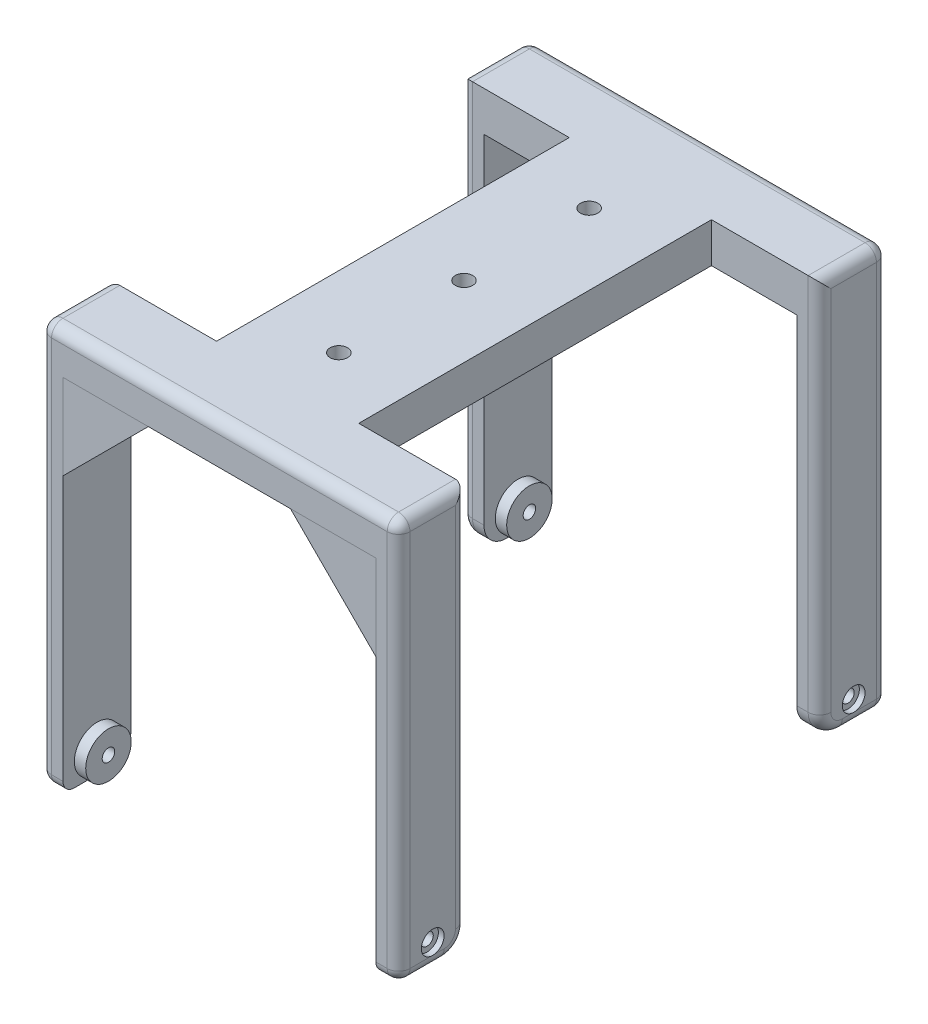
from build123d import *

# Parameters (mm, degrees)
SKETCH_1_W          = 63
SKETCH_1_H          = 12
EXTRUDE_1_DEPTH     = 70.5
SKETCH_2_W          = 55
SKETCH_2_H          = 63.5
CUT_EXTRUDE_1_DEPTH = 79.144097666
SKETCH_4_W          = 25
SKETCH_4_H          = 7
EXTRUDE_2_DEPTH     = 62
EXTRUDE_3_DEPTH     = 12
SKETCH_3_R          = 1.1
CUT_EXTRUDE_2_DEPTH = 124.851725866
EXTRUDE_START       = 2
SKETCH_7_R          = 4
SKETCH_7_R_2        = 1.1
EXTRUDE_4_DEPTH     = 2
SKETCH_8_R          = 4
SKETCH_8_R_2        = 1.1
EXTRUDE_5_DEPTH     = 2
EXTRUDE_6_DEPTH     = 4
EXTRUDE_6_2_DEPTH   = 4
EXTRUDE_7_DEPTH     = 4
SKETCH_9_R          = 1.1
CUT_EXTRUDE_3_DEPTH = 107.885452705
SKETCH_10_R         = 4.1
CUT_EXTRUDE_4_DEPTH = 2
SKETCH_11_R         = 2
CUT_EXTRUDE_5_DEPTH = 1
CUT_EXTRUDE_START   = -1
SKETCH_12_R         = 2
CUT_EXTRUDE_6_DEPTH = 1
SKETCH_15_R         = 1.525
CUT_EXTRUDE_7_DEPTH = 3
FILLET_1_R          = 4
FILLET_2_R          = 2
FILLET_3_R          = 2
FILLET_4_R          = 2


with BuildPart() as part:
    # 草图1 → 凸台-拉伸1 (new body)
    with BuildSketch(Plane(origin=(0, 0, 0), x_dir=(1, 0, 0), z_dir=(0, 1, 0))):
        Rectangle(SKETCH_1_W, SKETCH_1_H)
    extrude(amount=EXTRUDE_1_DEPTH)

    # 草图2 → 切除-拉伸1 (cut, through all)
    with BuildSketch(Plane.XY.offset(6)):
        with Locations((0, 31.75)):
            Rectangle(SKETCH_2_W, SKETCH_2_H)
    extrude(amount=-CUT_EXTRUDE_1_DEPTH, mode=Mode.SUBTRACT)

    # 草图4 → 凸台-拉伸2 (add)
    with BuildSketch(Plane(origin=(0, 0, -6), x_dir=(-1, 0, 0), z_dir=(0, 0, -1))):
        with Locations((0, 67)):
            Rectangle(SKETCH_4_W, SKETCH_4_H)
    extrude(amount=EXTRUDE_2_DEPTH)

    # 草图5 → 凸台-拉伸3 (add)
    with BuildSketch(Plane(origin=(0, 0, -68), x_dir=(-1, 0, 0), z_dir=(0, 0, -1))):
        Polygon((12.5, 63.5), (27.5, 63.5), (27.5, 0), (31.5, 0), (31.5, 70.5), (12.5, 70.5), (-12.5, 70.5), (-31.5, 70.5), (-31.5, 0), (-27.5, 0), (-27.5, 63.5), (-12.5, 63.5), align=None)
    extrude(amount=EXTRUDE_3_DEPTH)

    # 草图3 → 切除-拉伸2 (cut, through all)
    with BuildSketch(Plane(origin=(31.5, 0, 0), x_dir=(0, 0, -1), z_dir=(1, 0, 0))):
        with Locations((0, 4)):
            Circle(SKETCH_3_R)
        with Locations((74, 4)):
            Circle(SKETCH_3_R)
    extrude(amount=-CUT_EXTRUDE_2_DEPTH, mode=Mode.SUBTRACT)

    # 草图7 → 凸台-拉伸4 (add)
    # profile 1 of 2: a face of its own
    with BuildSketch(Plane(origin=(-27.5, 0, 0), x_dir=(0, 0, -1), z_dir=(1, 0, 0)).offset(EXTRUDE_START)):
        with Locations(Location((0, 4, 0), (0, 0, 270))):
            Circle(SKETCH_7_R)
        with Locations((0, 4)):
            Circle(SKETCH_7_R_2, mode=Mode.SUBTRACT)
    # profile 2 of 2: a face of its own
    with BuildSketch(Plane(origin=(-27.5, 0, 0), x_dir=(0, 0, -1), z_dir=(1, 0, 0)).offset(EXTRUDE_START)):
        with Locations(Location((74, 4, 0), (0, 0, 270))):
            Circle(SKETCH_7_R)
        with Locations((74, 4)):
            Circle(SKETCH_7_R_2, mode=Mode.SUBTRACT)
    extrude(amount=-EXTRUDE_4_DEPTH)

    # 草图8 → 凸台-拉伸5 (add)
    # profile 1 of 2: a face of its own
    with BuildSketch(Plane.ZY.offset(-27.5)):
        with Locations(Location((-74, 4, 0), (0, 0, 270))):
            Circle(SKETCH_8_R)
        with Locations(Location((-74, 4, 0), (0, 0, 180))):
            Circle(SKETCH_8_R_2, mode=Mode.SUBTRACT)
    # profile 2 of 2: a face of its own
    with BuildSketch(Plane.ZY.offset(-27.5)):
        with Locations(Location((0, 4, 0), (0, 0, 270))):
            Circle(SKETCH_8_R)
        with Locations(Location((0, 4, 0), (0, 0, 180))):
            Circle(SKETCH_8_R_2, mode=Mode.SUBTRACT)
    extrude(amount=EXTRUDE_5_DEPTH)

    # 草图14 → 凸台-拉伸7 (add)
    with BuildSketch(Plane(origin=(0, 0, -80), x_dir=(-1, 0, 0), z_dir=(0, 0, -1))):
        Polygon((27.5, 63.5), (12.5, 63.5), (27.5, 48.5), align=None)
        Polygon((-27.5, 63.5), (-27.5, 48.5), (-12.5, 63.5), align=None)
    extrude(amount=-EXTRUDE_7_DEPTH)

    # 草图9 → 切除-拉伸3 (cut, through all)
    with BuildSketch(Plane.XZ.offset(-63.5)):
        with Locations(Location((0, -15, 0), (0, 0, 270))):
            Circle(SKETCH_9_R)
        with Locations(Location((0, -59, 0), (0, 0, 270))):
            Circle(SKETCH_9_R)
        with Locations(Location((0, -37, 0), (0, 0, 270))):
            Circle(SKETCH_9_R)
    extrude(amount=-CUT_EXTRUDE_3_DEPTH, mode=Mode.SUBTRACT)

    # 草图10 → 切除-拉伸4 (cut)
    with BuildSketch(Plane.XZ.offset(-63.5)):
        with Locations(Location((0, -15, 0), (0, 0, 270))):
            Circle(SKETCH_10_R)
        with Locations(Location((0, -59, 0), (0, 0, 270))):
            Circle(SKETCH_10_R)
        with Locations(Location((0, -37, 0), (0, 0, 270))):
            Circle(SKETCH_10_R)
    extrude(amount=-CUT_EXTRUDE_4_DEPTH, mode=Mode.SUBTRACT)

    # 草图11 → 切除-拉伸5 (cut)
    with BuildSketch(Plane(origin=(31.5, 0, 0), x_dir=(0, 0, -1), z_dir=(1, 0, 0))):
        with Locations((0, 4)):
            Circle(SKETCH_11_R)
        with Locations((74, 4)):
            Circle(SKETCH_11_R)
    extrude(amount=-CUT_EXTRUDE_5_DEPTH, mode=Mode.SUBTRACT)

    # 草图12 → 切除-拉伸6 (cut)
    with BuildSketch(Plane.ZY.offset(31.5).offset(CUT_EXTRUDE_START)):
        with Locations(Location((-74, 4, 0), (0, 0, 180))):
            Circle(SKETCH_12_R)
        with Locations(Location((0, 4, 0), (0, 0, 180))):
            Circle(SKETCH_12_R)
    extrude(amount=CUT_EXTRUDE_6_DEPTH, mode=Mode.SUBTRACT)

    # 草图15 → 切除-拉伸7 (cut)
    with BuildSketch(Plane(origin=(0, 70.5, 0), x_dir=(1, 0, 0), z_dir=(0, 1, 0))):
        with Locations(Location((0, 59, 0), (0, 0, 270))):
            Circle(SKETCH_15_R)
        with Locations(Location((0, 37, 0), (0, 0, 270))):
            Circle(SKETCH_15_R)
        with Locations(Location((0, 15, 0), (0, 0, 270))):
            Circle(SKETCH_15_R)
    extrude(amount=-CUT_EXTRUDE_7_DEPTH, mode=Mode.SUBTRACT)

    # 圆角1
    fillet_1_edges = [part.edges().sort_by_distance(p)[0] for p in [
        (-29.5, 0, -6),
        (29.5, 0, -68),
        (-29.5, 0, -68),
        (29.5, 0, -6),
    ]]
    fillet(fillet_1_edges, radius=FILLET_1_R)

    # 圆角2
    fillet_2_edges = [part.edges().sort_by_distance(p)[0] for p in [
        (29.5, 0, 6),
        (-29.5, 0, 6),
        (29.5, 0, -80),
        (-29.5, 0, -80),
    ]]
    fillet(fillet_2_edges, radius=FILLET_2_R)

    # 圆角3
    fillet_3_edges = [part.edges().sort_by_distance(p)[0] for p in [
        (0, 70.5, 6),
        (0, 70.5, -80),
    ]]
    fillet(fillet_3_edges, radius=FILLET_3_R)

    # 圆角4
    fillet_4_edges = [part.edges().sort_by_distance(p)[0] for p in [
        (-31.5, 70.5, -1),
        (31.5, 1.171572875, -69.171572875),
        (31.5, 1.171572875, -4.828427125),
        (-31.5, 0, 1),
        (-31.5, 1.171572875, -4.828427125),
        (-31.5, 37.25, -68),
        (-31.5, 1.171572875, -69.171572875),
        (-31.5, 35.25, -80),
        (31.5, 0, -75),
        (31.5, 0.585786438, -79.414213562),
        (-31.5, 0, -75),
        (-31.5, 0.585786438, -79.414213562),
        (-31.5, 0.585786438, 5.414213562),
        (31.5, 0, 1),
        (31.5, 0.585786438, 5.414213562),
        (31.5, 70.5, -1),
        (31.5, 70.5, -73),
        (-31.5, 70.5, -73),
        (31.5, 35.25, 6),
        (31.5, 69.914213562, 5.414213562),
        (-31.5, 35.25, 6),
        (-31.5, 69.914213562, 5.414213562),
        (31.5, 35.25, -80),
        (31.5, 69.914213562, -79.414213562),
        (-31.5, 69.914213562, -79.414213562),
        (31.5, 37.25, -68),
        (-31.5, 37.25, -6),
        (31.5, 37.25, -6),
    ]]
    fillet(fillet_4_edges, radius=FILLET_4_R - 0.0001)  # a hair under: the kernel refuses the full size


with BuildPart() as body_2:
    # 草图13 → 凸台-拉伸6 (new body)
    with BuildSketch(Plane.XY.offset(6)):
        Polygon((-27.5, 63.5), (-27.5, 48.5), (-12.5, 63.5), align=None)
    extrude(amount=-EXTRUDE_6_DEPTH)


with BuildPart() as body_3:
    # 草图13 → Extrude 6 2 (new body)
    with BuildSketch(Plane.XY.offset(6)):
        Polygon((27.5, 48.5), (12.5, 63.5), (27.5, 63.5), align=None)
    extrude(amount=-EXTRUDE_6_2_DEPTH)


solid = Compound([part.part, body_2.part, body_3.part])
